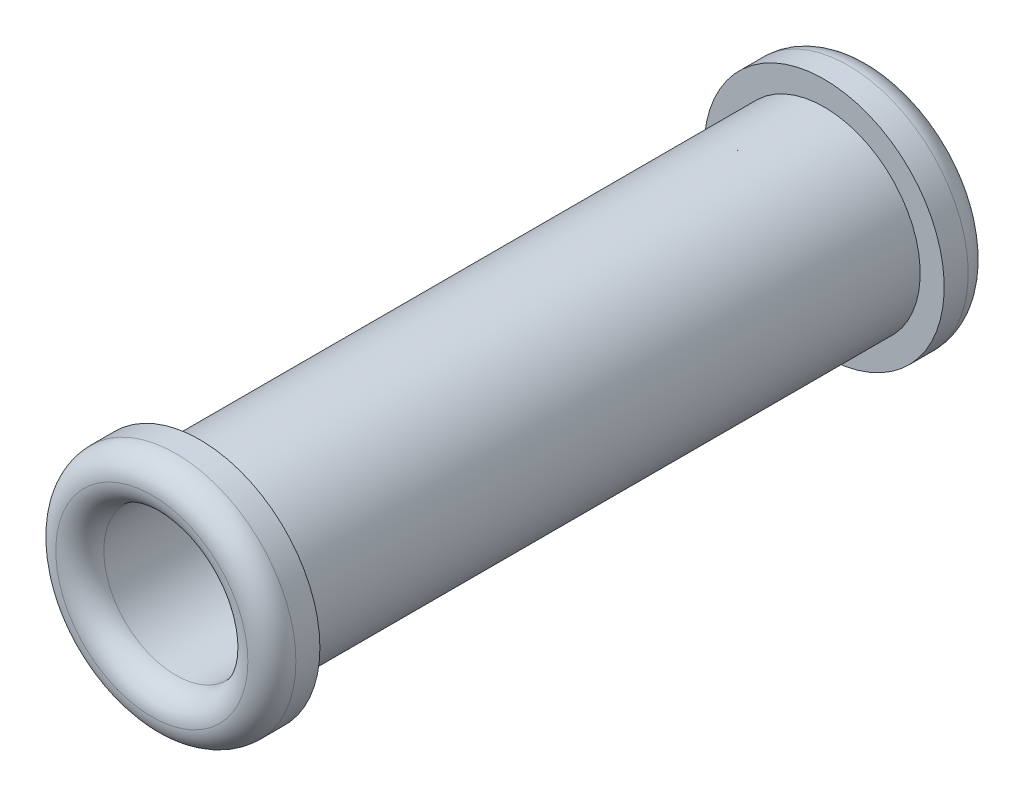
from build123d import *

# Parameters (mm, degrees)
SKETCH1_R           = 1
BOSS_EXTRUDE1_DEPTH = 6.5
SKETCH2_R           = 1.25
BOSS_EXTRUDE2_DEPTH = 0.5
BOSS_EXTRUDE3_START = 0.5
SKETCH3_R           = 1.25
BOSS_EXTRUDE3_DEPTH = 0.5
SKETCH4_R           = 0.75
CUT_EXTRUDE1_DEPTH  = 10.5
FILLET1_R           = 0.25


with BuildPart() as part:
    # Sketch1 → Boss-Extrude1 (new body)
    with BuildSketch(Plane.XY):
        with Locations(Location((0, 0, 0), (0, 0, 180))):
            Circle(SKETCH1_R)
    extrude(amount=BOSS_EXTRUDE1_DEPTH)

    # Sketch2 → Boss-Extrude2 (add)
    with BuildSketch(Plane.XY.offset(6.5)):
        Circle(SKETCH2_R)
    extrude(amount=BOSS_EXTRUDE2_DEPTH)

    # Sketch3 → Boss-Extrude3 (add)
    with BuildSketch(Plane(origin=(0, 0, 0), x_dir=(-1, 0, 0), z_dir=(0, 0, -1)).offset(BOSS_EXTRUDE3_START)):
        with Locations(Location((0, 0, 0), (0, 0, 180))):
            Circle(SKETCH3_R)
    extrude(amount=-BOSS_EXTRUDE3_DEPTH)

    # Sketch4 → Cut-Extrude1 (cut)
    with BuildSketch(Plane.XY.offset(7)):
        Circle(SKETCH4_R)
    extrude(amount=-CUT_EXTRUDE1_DEPTH, mode=Mode.SUBTRACT)

    # Fillet1
    fillet1_edges = [part.edges().sort_by_distance(p)[0] for p in [
        (-1.25, 0, -0.5),
        (-0.75, 0, -0.5),
        (-0.75, 0, 7),
        (-1.25, 0, 7),
    ]]
    fillet(fillet1_edges, radius=FILLET1_R - 0.0001)  # a hair under: the kernel refuses the full size


solid = part.part
